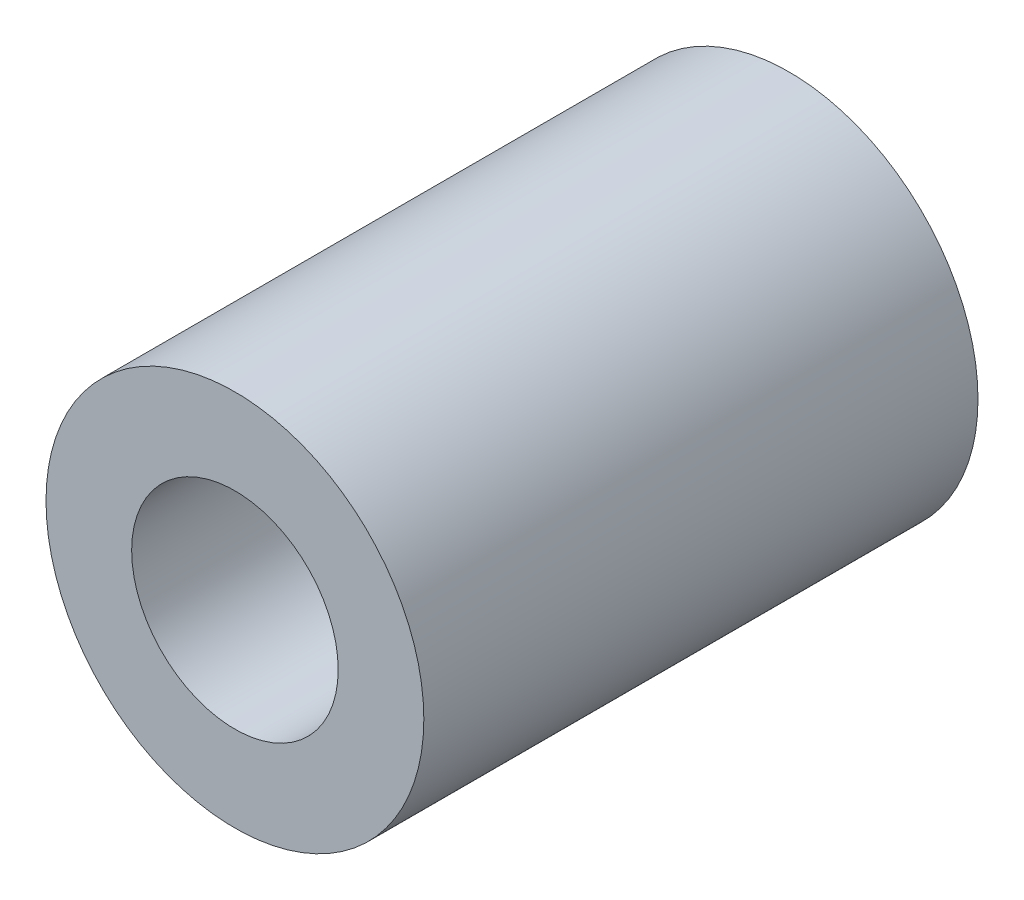
from build123d import *

# Parameters (mm, degrees)
SKETCH1_R           = 7.5
SKETCH1_R_2         = 4.1
BOSS_EXTRUDE1_DEPTH = 22


with BuildPart() as part:
    # Sketch1 → Boss-Extrude1 (new body)
    with BuildSketch(Plane.XY):
        Circle(SKETCH1_R)
        Circle(SKETCH1_R_2, mode=Mode.SUBTRACT)
    extrude(amount=BOSS_EXTRUDE1_DEPTH)


solid = part.part
